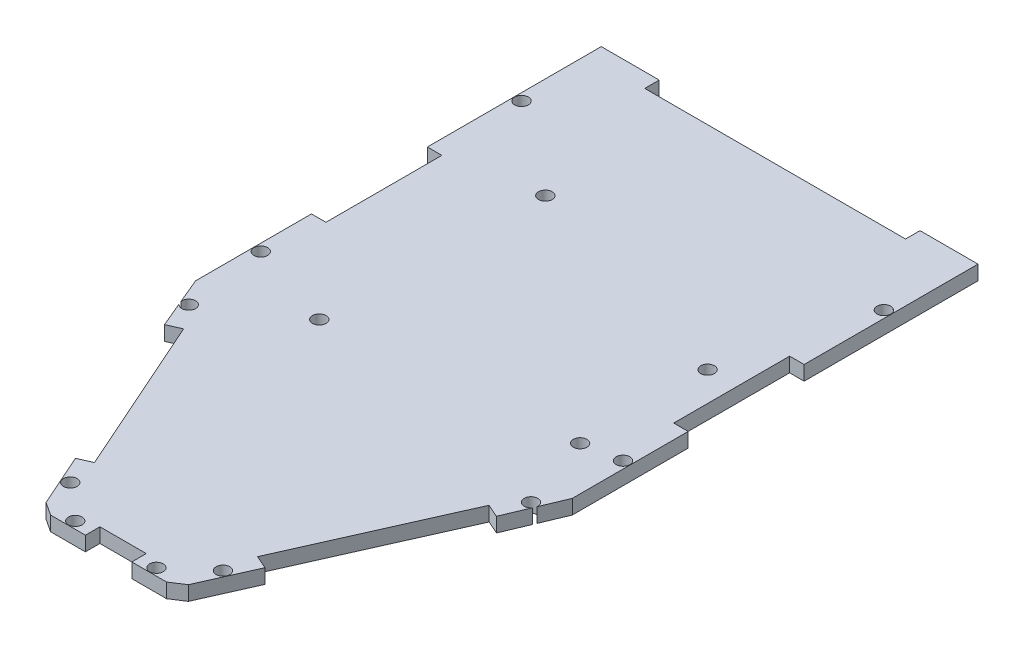
from build123d import *

# Parameters (mm, degrees)
BOSS_EXTRUDE1_DEPTH = 3.175
SKETCH2_R           = 1.5
SKETCH2_R_2         = 1.500000048
CUT_EXTRUDE1_DEPTH  = 99.065877093
SKETCH4_R           = 1.5
CUT_EXTRUDE3_DEPTH  = 99.065877093


with BuildPart() as part:
    # Sketch1 → Boss-Extrude1 (new body)
    with BuildSketch(Plane(origin=(0, 0, 0), x_dir=(1, 0, 0), z_dir=(0, 1, 0))):
        Polygon((-41.275, 0), (-36.368301991, -11.713851401), (-33.466950324, -10.424361771), (-17.857958519, -45.544593333), (-20.759310186, -46.834082962), (-15.601351667, -58.43948963), (-12.7, -60.325), (-5.08, -60.325), (-5.08, -57.15), (5.08, -57.15), (5.08, -60.325), (12.7, -60.325), (15.601351667, -58.43948963), (20.759310186, -46.834082962), (17.857958519, -45.544593333), (33.466950324, -10.424361771), (36.368301991, -11.713851401), (41.275, 0), (41.275, 25.4), (38.1, 25.4), (38.1, 50.8), (41.275, 50.8), (41.275, 88.9), (28.575, 88.9), (28.575, 85.725), (3.175, 85.725), (-3.175, 85.725), (-28.575, 85.725), (-28.575, 88.9), (-41.275, 88.9), (-41.275, 50.8), (-38.1, 50.8), (-38.1, 25.4), (-41.275, 25.4), align=None)
    extrude(amount=BOSS_EXTRUDE1_DEPTH)

    # Sketch2 → Cut-Extrude1 (cut, through all)
    with BuildSketch(Plane(origin=(0, 0, 0), x_dir=(-1, 0, 0), z_dir=(0, -1, 0))):
        with Locations((39.6875, 69.85)):
            Circle(SKETCH2_R)
        with Locations((-8.89, -58.7375)):
            Circle(SKETCH2_R_2)
        with Locations((39.6875, 12.7)):
            Circle(SKETCH2_R_2)
        with Locations((37.496605417, -5.266403252)):
            Circle(SKETCH2_R_2)
        with Locations((16.729655093, -51.992041481)):
            Circle(SKETCH2_R_2)
        with Locations((8.89, -58.7375)):
            Circle(SKETCH2_R_2)
        with Locations((-16.729655093, -51.992041481)):
            Circle(SKETCH2_R_2)
        with Locations((-37.496605417, -5.266403252)):
            Circle(SKETCH2_R_2)
        with Locations((-39.6875, 12.7)):
            Circle(SKETCH2_R_2)
        with Locations((-39.6875, 69.85)):
            Circle(SKETCH2_R)
    extrude(amount=-CUT_EXTRUDE1_DEPTH, mode=Mode.SUBTRACT)

    # Sketch4 → Cut-Extrude3 (cut, through all)
    with BuildSketch(Plane(origin=(0, 3.175, 0), x_dir=(1, 0, 0), z_dir=(0, 1, 0))):
        with Locations((31.681488655, 11.305)):
            Circle(SKETCH4_R)
        with Locations((31.681488655, 39.245)):
            Circle(SKETCH4_R)
        with Locations((-20.388511345, 6.225)):
            Circle(SKETCH4_R)
        with Locations((-19.118511345, 54.485)):
            Circle(SKETCH4_R)
    extrude(amount=-CUT_EXTRUDE3_DEPTH, mode=Mode.SUBTRACT)


solid = part.part
